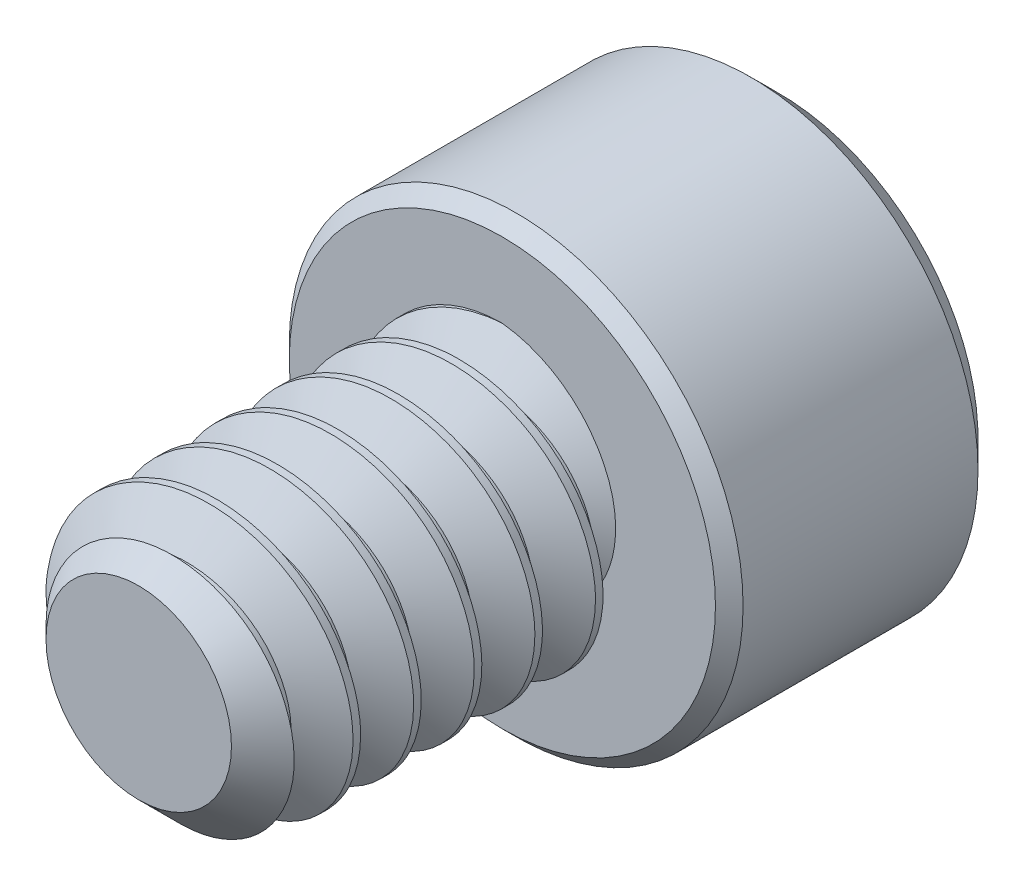
from build123d import *

# Parameters (mm, degrees)
SKETCH1_R          = 2.413
EXTRUDE1_DEPTH     = 6.35
CHAMFER3_SIZE      = 0.79375
CUT_SWEEP1_PITCH   = 1.058333333
SKETCH6_R          = 3.9624
EXTRUDE2_DEPTH     = 4.826
CUT_EXTRUDE1_DEPTH = 2.9765625
SKETCH8_R          = 2.291358881
CUT_EXTRUDE2_DEPTH = 0.4826
CUT_EXTRUDE2_DRAFT = -45
CHAMFER1_SIZE      = 0.4826
CHAMFER2_SIZE      = 0.2413


with BuildPart() as part:
    # Sketch1 → Extrude1 (new body)
    with BuildSketch(Plane.XY):
        Circle(SKETCH1_R)
    extrude(amount=-EXTRUDE1_DEPTH)

    # Chamfer3
    chamfer3_edges = [part.edges().sort_by_distance(p)[0] for p in [
        (-2.413, 0, 0),
    ]]
    chamfer(chamfer3_edges, length=CHAMFER3_SIZE)

    # Cut-Sweep1: the profile of Sketch3 profile screwed along a right-hand helix of 7 turns, 6 arcs to a turn; built about Z, then put on its axis
    cut_sweep1_z = Axis((0, 0, 0), (0, 0, 1))
    cut_sweep1_corners = [(2.4133, 0, -0.926214872), (1.725592336, 0, -0.529166667), (1.725592336, 0, -0.396875), (2.4133, 0, 0.000173205)]
    with BuildLine(mode=Mode.PRIVATE) as cut_sweep1_profile:
        Line(cut_sweep1_corners[0], cut_sweep1_corners[1])
        Line(cut_sweep1_corners[1], cut_sweep1_corners[2])
        Line(cut_sweep1_corners[2], cut_sweep1_corners[3])
        Line(cut_sweep1_corners[3], cut_sweep1_corners[0])
    cut_sweep1_cap = Face(cut_sweep1_profile.wire())
    cut_sweep1_turn_angles = [0, 30, 60, 90, 120, 150, 180, 210, 240, 270, 300, 330, 360]
    cut_sweep1_turn_weights = [1, 0.8660254037844387, 1, 0.8660254037844387, 1, 0.8660254037844387, 1, 0.8660254037844387, 1, 0.8660254037844387, 1, 0.8660254037844387, 1]
    cut_sweep1_turn_rails = [Edge.make_bspline([Vector(p[0], p[1], 0).rotate(cut_sweep1_z, cut_sweep1_turn_angles[k]) / cut_sweep1_turn_weights[k] + Vector(0, 0, p[2] + CUT_SWEEP1_PITCH * cut_sweep1_turn_angles[k] / 360) for k in range(13)], [0, 0, 0, 1, 1, 2, 2, 3, 3, 4, 4, 5, 5, 6, 6, 6], 2, cut_sweep1_turn_weights) for p in cut_sweep1_corners]
    cut_sweep1_turn_sides = [Face.make_surface_from_curves(cut_sweep1_turn_rails[p[0]], cut_sweep1_turn_rails[p[1]]) for p in [(0, 1), (1, 2), (2, 3), (3, 0)]]
    cut_sweep1 = Plane(origin=(0, 0, 0), x_dir=(0, 1, 0), z_dir=(0, 0, -1)) * Solid(Shell([*[p.moved(Location((0, 0, CUT_SWEEP1_PITCH * i))) for i in range(7) for p in cut_sweep1_turn_sides], cut_sweep1_cap, cut_sweep1_cap.rotate(cut_sweep1_z, 2520).moved(Location((0, 0, CUT_SWEEP1_PITCH * 2520 / 360)))]))
    add(cut_sweep1, mode=Mode.SUBTRACT)

    # Sketch6 → Extrude2 (add)
    with BuildSketch(Plane(origin=(0, 0, -6.35), x_dir=(-1, 0, 0), z_dir=(0, 0, -1))):
        Circle(SKETCH6_R)
    extrude(amount=EXTRUDE2_DEPTH)

    # Sketch7 → Cut-Extrude1 (cut)
    with BuildSketch(Plane(origin=(0, 0, -11.176), x_dir=(-1, 0, 0), z_dir=(0, 0, -1))):
        Polygon((0, 2.291358881), (-1.984375, 1.14567944), (-1.984375, -1.14567944), (0, -2.291358881), (1.984375, -1.14567944), (1.984375, 1.14567944), align=None)
    extrude(amount=-CUT_EXTRUDE1_DEPTH, mode=Mode.SUBTRACT)


with BuildPart() as cut_extrude2_tool:
    # Sketch8 → Cut-Extrude2 (with draft: the straight prism first)
    with BuildSketch(Plane(origin=(0, 0, -11.176), x_dir=(-1, 0, 0), z_dir=(0, 0, -1))):
        Circle(SKETCH8_R)
    extrude(amount=-CUT_EXTRUDE2_DEPTH)
    # Cut-Extrude2: the draft: its side faces are tilted about the plane it starts from
    cut_extrude2_sides = [cut_extrude2_tool.faces().sort_by_distance(p)[0] for p in [
        (2.291358881, 0, -10.9347),
    ]]
    draft(cut_extrude2_sides, Plane(origin=(0, 0, -11.176), x_dir=(-1, 0, 0), z_dir=(0, 0, -1)), CUT_EXTRUDE2_DRAFT)


with BuildPart() as part_1:
    add(part.part)

    # Cut-Extrude2: cut by cut_extrude2_tool
    add(cut_extrude2_tool.part, mode=Mode.SUBTRACT)

    # Chamfer1
    chamfer1_edges = [part_1.edges().sort_by_distance(p)[0] for p in [
        (3.9624, 0, -11.176),
    ]]
    chamfer(chamfer1_edges, length=CHAMFER1_SIZE)

    # Chamfer2
    chamfer2_edges = [part_1.edges().sort_by_distance(p)[0] for p in [
        (3.9624, 0, -6.35),
    ]]
    chamfer(chamfer2_edges, length=CHAMFER2_SIZE)


solid = part_1.part
